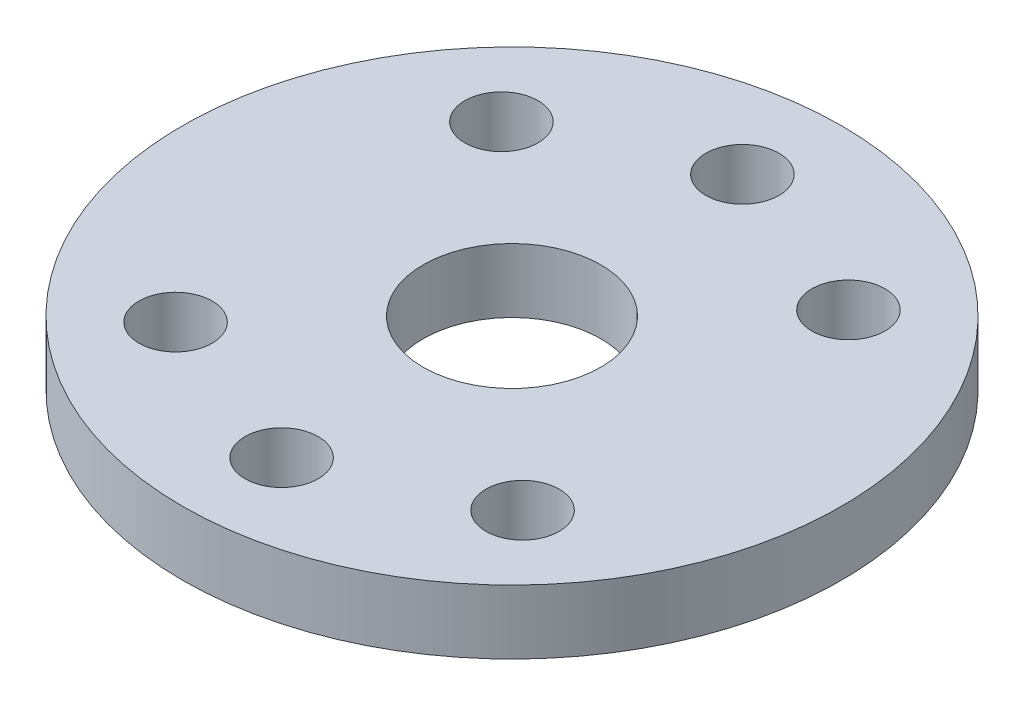
from build123d import *

# Parameters (mm, degrees)
SKETCH_1_R          = 18
SKETCH_1_R_2        = 4.85
EXTRUDE_1_DEPTH     = 3.5
SKETCH_2_R          = 2
CUT_EXTRUDE_1_DEPTH = 26.695330315


with BuildPart() as part:
    # Эскиз1 → Вытянуть1 (new body)
    with BuildSketch(Plane(origin=(0, 0, 0), x_dir=(1, 0, 0), z_dir=(0, 1, 0))):
        Circle(SKETCH_1_R)
        Circle(SKETCH_1_R_2, mode=Mode.SUBTRACT)
    extrude(amount=EXTRUDE_1_DEPTH)

    # Эскиз2 → Вырез-Вытянуть1 (cut, through all)
    with BuildSketch(Plane(origin=(0, 3.5, 0), x_dir=(1, 0, 0), z_dir=(0, 1, 0))):
        with Locations((-0.408987172, 12.993564926)):
            Circle(SKETCH_2_R)
        with Locations((-9.477035474, 8.898640269)):
            Circle(SKETCH_2_R)
        with Locations((8.898640269, 9.477035474)):
            Circle(SKETCH_2_R)
        with Locations((9.477035474, -8.898640269)):
            Circle(SKETCH_2_R)
        with Locations((0.408987172, -12.993564926)):
            Circle(SKETCH_2_R)
        with Locations((-8.898640269, -9.477035474)):
            Circle(SKETCH_2_R)
    extrude(amount=-CUT_EXTRUDE_1_DEPTH, mode=Mode.SUBTRACT)


solid = part.part
